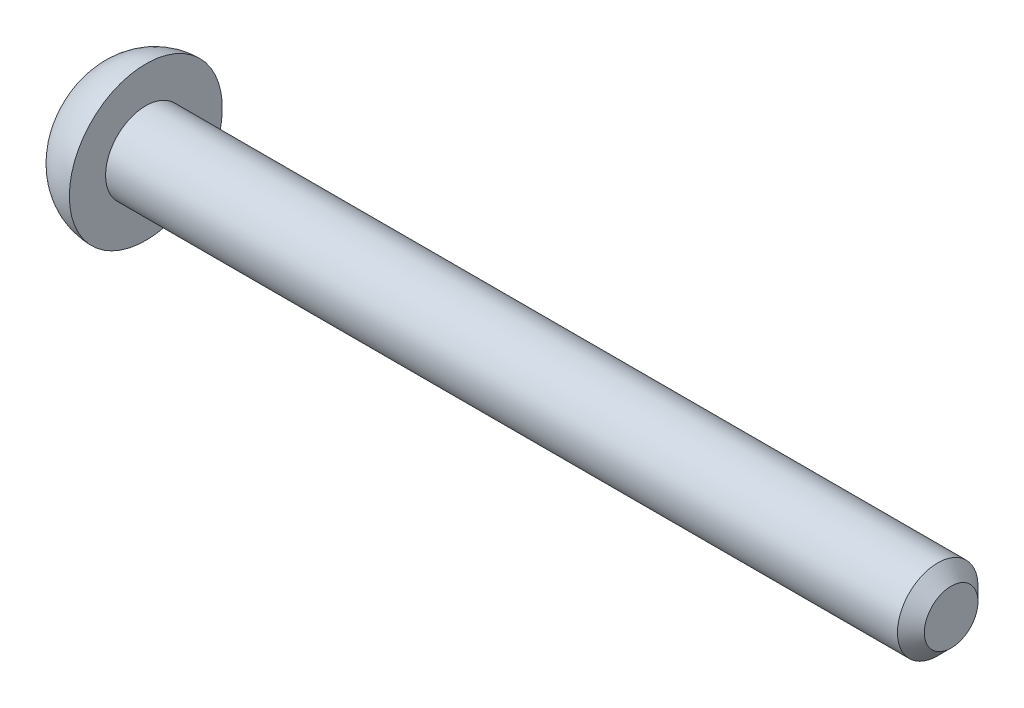
from build123d import *

# Parameters (mm, degrees)
CHAMFER1_SIZE      = 0.5
CUT_EXTRUDE1_DEPTH = 1


with BuildPart() as part:
    # Sketch2 → Revolve1 (revolve)
    with BuildSketch(Plane(origin=(0, 0, 0), x_dir=(1, 0, 0), z_dir=(0, 1, 0))):
        with BuildLine():
            Line((0, 0), (0, 1.5))
            Line((0, 1.5), (-30, 1.5))
            Line((-30, 1.5), (-30, 2.85))
            ThreePointArc((-30, 2.85), (-30.917065968, 2.639177072), (-31.65, 2.049038106))
            Line((-31.65, 2.049038106), (-31.65, 0))
            Line((-31.65, 0), (0, 0))
        make_face()
    revolve(axis=Axis((-31.65, 0, 0), (1, 0, 0)))

    # Chamfer1
    chamfer1_edges = [part.edges().sort_by_distance(p)[0] for p in [
        (0, 0, 1.5),
    ]]
    chamfer(chamfer1_edges, length=CHAMFER1_SIZE)

    # Sketch4 → Cut-Extrude1 (cut)
    with BuildSketch(Plane.ZY.offset(31.65)):
        with BuildLine():
            ThreePointArc((-1.342027284, 0.090739778), (-0.883315009, 0.509982158), (-0.749596595, 1.116859832))
            ThreePointArc((-0.749596595, 1.116859832), (-0.7, 1.212435565), (-0.592430689, 1.20759961))
            ThreePointArc((-0.592430689, 1.20759961), (0, 1.019964317), (0.592430689, 1.20759961))
            ThreePointArc((0.592430689, 1.20759961), (0.7, 1.212435565), (0.749596595, 1.116859832))
            ThreePointArc((0.749596595, 1.116859832), (0.883315009, 0.509982158), (1.342027284, 0.090739778))
            ThreePointArc((1.342027284, 0.090739778), (1.4, 0), (1.342027284, -0.090739778))
            ThreePointArc((1.342027284, -0.090739778), (0.883315009, -0.509982158), (0.749596595, -1.116859832))
            ThreePointArc((0.749596595, -1.116859832), (0.7, -1.212435565), (0.592430689, -1.20759961))
            ThreePointArc((0.592430689, -1.20759961), (0, -1.019964317), (-0.592430689, -1.20759961))
            ThreePointArc((-0.592430689, -1.20759961), (-0.7, -1.212435565), (-0.749596595, -1.116859832))
            ThreePointArc((-0.749596595, -1.116859832), (-0.883315009, -0.509982158), (-1.342027284, -0.090739778))
            ThreePointArc((-1.342027284, -0.090739778), (-1.4, 0), (-1.342027284, 0.090739778))
        make_face()
    extrude(amount=-CUT_EXTRUDE1_DEPTH, mode=Mode.SUBTRACT)


solid = part.part
